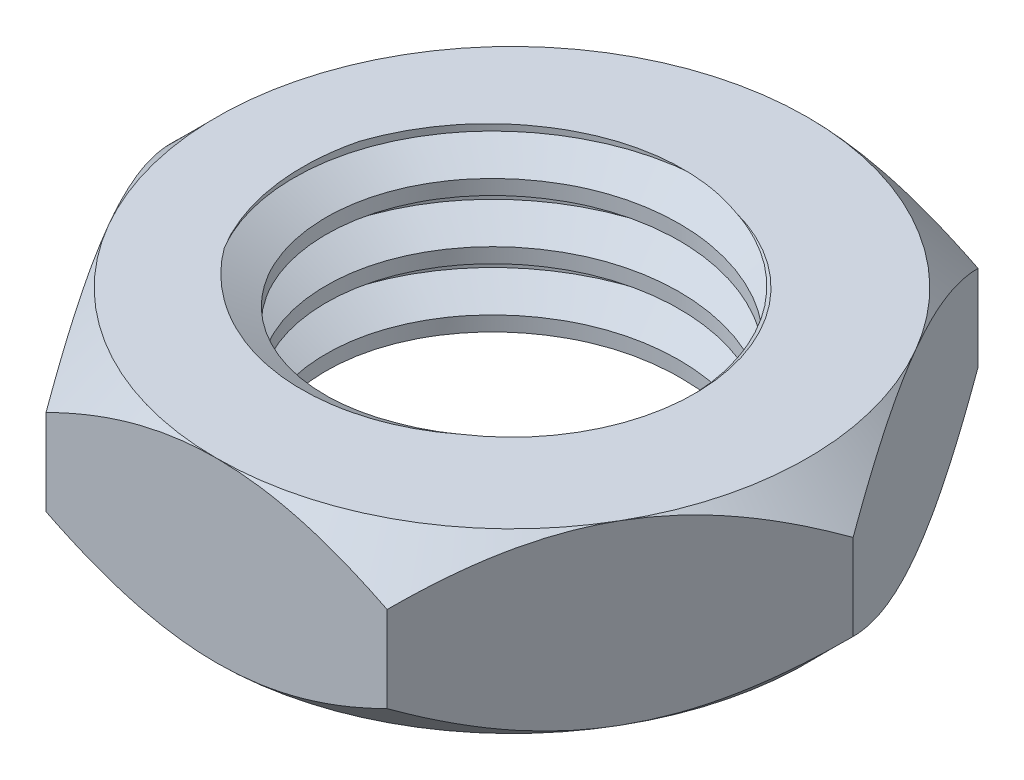
from build123d import *

# Parameters (mm, degrees)
BOSS_EXTRUDE1_DEPTH     = 0.75
SKETCH2_OUTSIDE_W       = 19.536
SKETCH2_OUTSIDE_H       = 18.762
SKETCH2_OUTSIDE_R       = 2.5
CUT_EXTRUDE1_DEPTH      = 5.102844542
CUT_EXTRUDE1_DRAFT      = -45
MIRROR1_COPY_1_SKETCH_W = 19.536
MIRROR1_COPY_1_SKETCH_H = 18.762
MIRROR1_COPY_1_SKETCH_R = 2.5
MIRROR1_COPY_1_DEPTH    = 5.102844542
MIRROR1_COPY_1_DRAFT    = -45
SKETCH3_R               = 1.5
CUT_EXTRUDE2_DEPTH      = 5.102844542
CHAMFER1_SIZE           = 0.05
THREAD1_PITCH           = 0.5


with BuildPart() as part:
    # Sketch1 → Boss-Extrude1 (new, symmetric)
    with BuildSketch(Plane(origin=(0, 0, 0), x_dir=(1, 0, 0), z_dir=(0, 1, 0))):
        Polygon((2.886751346, 0), (1.443375673, 2.5), (-1.443375673, 2.5), (-2.886751346, 0), (-1.443375673, -2.5), (1.443375673, -2.5), align=None)
    extrude(amount=BOSS_EXTRUDE1_DEPTH, both=True)


with BuildPart() as cut_extrude1_tool:
    # Sketch2 outside → Cut-Extrude1 (with draft: the straight prism first)
    with BuildSketch(Plane(origin=(0, 0.75, 0), x_dir=(1, 0, 0), z_dir=(0, 1, 0))):
        Rectangle(SKETCH2_OUTSIDE_W, SKETCH2_OUTSIDE_H)
        Circle(SKETCH2_OUTSIDE_R, mode=Mode.SUBTRACT)
    extrude(amount=-CUT_EXTRUDE1_DEPTH)
    # Cut-Extrude1: the draft: its side faces are tilted about the plane it starts from
    cut_extrude1_sides = [cut_extrude1_tool.faces().sort_by_distance(p)[0] for p in [
        (0, -1.801422271, 9.381),
        (9.768, -1.801422271, 0),
        (0, -1.801422271, -9.381),
        (-9.768, -1.801422271, 0),
        (-2.5, -1.801422271, 0),
    ]]
    draft(cut_extrude1_sides, Plane(origin=(0, 0.75, 0), x_dir=(1, 0, 0), z_dir=(0, 1, 0)), CUT_EXTRUDE1_DRAFT)


with BuildPart() as part_1:
    add(part.part)

    # Cut-Extrude1: cut by cut_extrude1_tool
    add(cut_extrude1_tool.part, mode=Mode.SUBTRACT)


with BuildPart() as mirror1_copy_1_tool:
    # Mirror1 copy 1 sketch → Mirror1 copy 1 (with draft: the straight prism first)
    with BuildSketch(Plane.XZ.offset(0.75)):
        Rectangle(MIRROR1_COPY_1_SKETCH_W, MIRROR1_COPY_1_SKETCH_H)
        Circle(MIRROR1_COPY_1_SKETCH_R, mode=Mode.SUBTRACT)
    extrude(amount=-MIRROR1_COPY_1_DEPTH)
    # Mirror1 copy 1: the draft: its side faces are tilted about the plane it starts from
    mirror1_copy_1_sides = [mirror1_copy_1_tool.faces().sort_by_distance(p)[0] for p in [
        (0, 1.801422271, 9.381),
        (9.768, 1.801422271, 0),
        (0, 1.801422271, -9.381),
        (-9.768, 1.801422271, 0),
        (-2.5, 1.801422271, 0),
    ]]
    draft(mirror1_copy_1_sides, Plane.XZ.offset(0.75), MIRROR1_COPY_1_DRAFT)


with BuildPart() as part_2:
    add(part_1.part)

    # Mirror1 copy 1: cut by mirror1_copy_1_tool
    add(mirror1_copy_1_tool.part, mode=Mode.SUBTRACT)

    # Sketch3 → Cut-Extrude2 (cut, through all)
    with BuildSketch(Plane(origin=(0, 0.75, 0), x_dir=(1, 0, 0), z_dir=(0, 1, 0))):
        with Locations(Location((0, 0, 0), (0, 0, 270))):
            Circle(SKETCH3_R)
    extrude(amount=-CUT_EXTRUDE2_DEPTH, mode=Mode.SUBTRACT)

    # Chamfer1
    chamfer1_edges = [part_2.edges().sort_by_distance(p)[0] for p in [
        (0, -0.75, -1.5),
        (0, 0.75, -1.5),
    ]]
    chamfer(chamfer1_edges, length=CHAMFER1_SIZE)

    # Thread1: the profile of Thread Profile1 profile screwed along a right-hand helix of 4.9 turns, 6 arcs to a turn; built about Z, then put on its axis
    thread1_z = Axis((0, 0, 0), (0, 0, 1))
    thread1_corners = [(1.4997, 0, -0.000173205), (1.770632938, 0, 0.156249999), (1.770632938, 0, 0.218749999), (1.4997, 0, 0.375173204)]
    with BuildLine(mode=Mode.PRIVATE) as thread1_profile:
        Line(thread1_corners[0], thread1_corners[1])
        Line(thread1_corners[1], thread1_corners[2])
        Line(thread1_corners[2], thread1_corners[3])
        Line(thread1_corners[3], thread1_corners[0])
    thread1_cap = Face(thread1_profile.wire())
    thread1_turn_angles = [0, 30, 60, 90, 120, 150, 180, 210, 240, 270, 300, 330, 360]
    thread1_turn_weights = [1, 0.8660254037844387, 1, 0.8660254037844387, 1, 0.8660254037844387, 1, 0.8660254037844387, 1, 0.8660254037844387, 1, 0.8660254037844387, 1]
    thread1_turn_rails = [Edge.make_bspline([Vector(p[0], p[1], 0).rotate(thread1_z, thread1_turn_angles[k]) / thread1_turn_weights[k] + Vector(0, 0, p[2] + THREAD1_PITCH * thread1_turn_angles[k] / 360) for k in range(13)], [0, 0, 0, 1, 1, 2, 2, 3, 3, 4, 4, 5, 5, 6, 6, 6], 2, thread1_turn_weights) for p in thread1_corners]
    thread1_turn_sides = [Face.make_surface_from_curves(thread1_turn_rails[p[0]], thread1_turn_rails[p[1]]) for p in [(0, 1), (1, 2), (2, 3), (3, 0)]]
    thread1_last_angles = [1440, 1470, 1500, 1530, 1560, 1590, 1620, 1650, 1680, 1710, 1740, 1752, 1764]
    thread1_last_weights = [1, 0.8660254037844387, 1, 0.8660254037844387, 1, 0.8660254037844387, 1, 0.8660254037844387, 1, 0.8660254037844387, 1, 0.9781476007338048, 1]
    thread1_last_rails = [Edge.make_bspline([Vector(p[0], p[1], 0).rotate(thread1_z, thread1_last_angles[k]) / thread1_last_weights[k] + Vector(0, 0, p[2] + THREAD1_PITCH * thread1_last_angles[k] / 360) for k in range(13)], [0, 0, 0, 1, 1, 2, 2, 3, 3, 4, 4, 5, 5, 6, 6, 6], 2, thread1_last_weights) for p in thread1_corners]
    thread1_last_sides = [Face.make_surface_from_curves(thread1_last_rails[p[0]], thread1_last_rails[p[1]]) for p in [(0, 1), (1, 2), (2, 3), (3, 0)]]
    thread1 = Plane(origin=(0, -1.7, 0), x_dir=(1, 0, 0), z_dir=(0, 1, 0)) * Solid(Shell([*[p.moved(Location((0, 0, THREAD1_PITCH * i))) for i in range(4) for p in thread1_turn_sides], *thread1_last_sides, thread1_cap, thread1_cap.rotate(thread1_z, 1764).moved(Location((0, 0, THREAD1_PITCH * 1764 / 360)))]))
    add(thread1, mode=Mode.SUBTRACT)


solid = part_2.part
